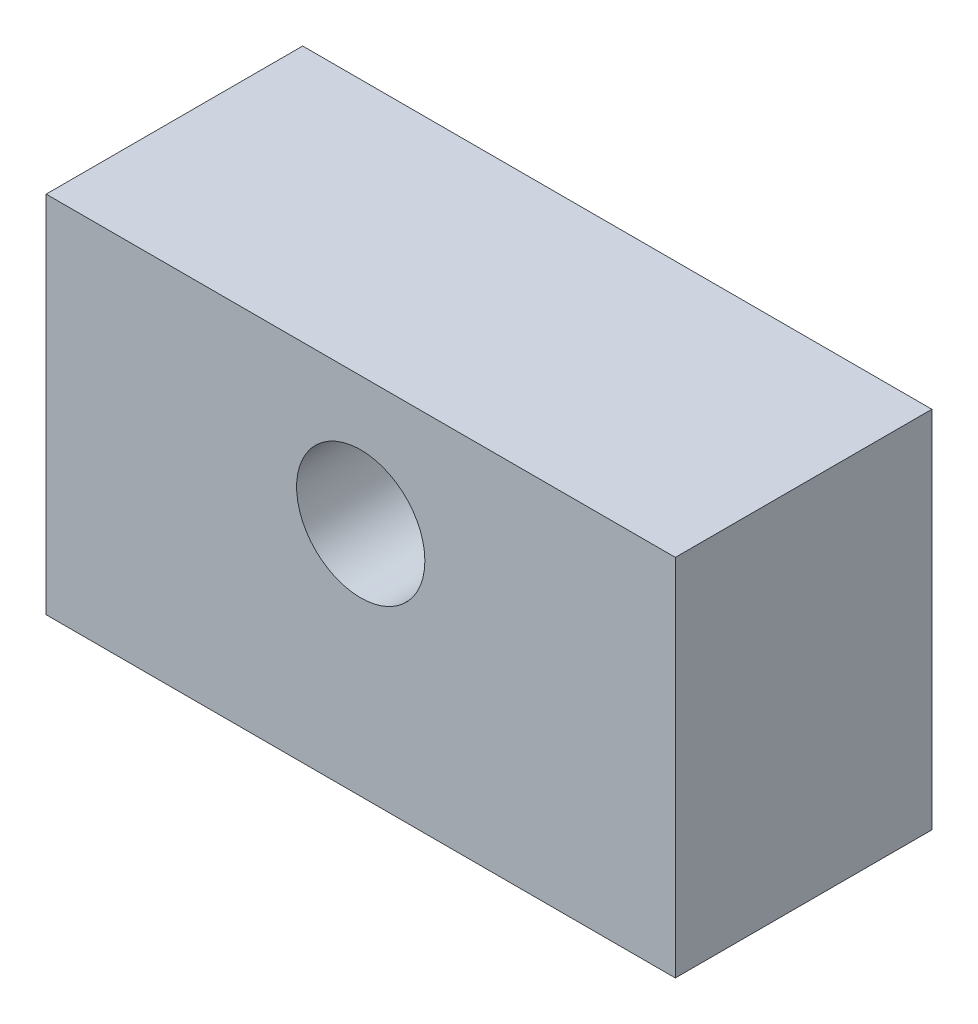
from build123d import *
from build123d.topology import SkipClean

# Parameters (mm, degrees)
SKETCH3_W                      = 31.148374891
SKETCH3_H                      = 19.837641971
BOSS_EXTRUDE1_DEPTH            = 6.35
SKETCH4_R                      = 3.175
CUT_EXTRUDE1_DEPTH             = 9.525
SKETCH5_R                      = 3.175
CUT_EXTRUDE5_DEPTH             = 9.525
CUT_EXTRUDE5_DIRECTION_2_REACH = 33.299
SKETCH6_R                      = 3.175
CUT_EXTRUDE6_DEPTH             = 9.525
SKETCH7_W                      = 12.7
SKETCH7_H                      = 1.803641971
CUT_EXTRUDE7_DEPTH             = 38.470999417


with BuildPart() as part:
    # Sketch3 → Boss-Extrude1 (new, symmetric)
    with BuildSketch(Plane.XY):
        with Locations((15.574187446, -9.918820986)):
            Rectangle(SKETCH3_W, SKETCH3_H)
    extrude(amount=BOSS_EXTRUDE1_DEPTH, both=True)

    # Sketch4 → Cut-Extrude1 (cut)
    with BuildSketch(Plane.ZY):
        with Locations((0, -6.35)):
            Circle(SKETCH4_R)
    extrude(amount=-CUT_EXTRUDE1_DEPTH, mode=Mode.SUBTRACT)

    # Sketch5 → Cut-Extrude5 (cut)
    with BuildSketch(Plane(origin=(7.787093723, -19.837641971, 0), x_dir=(-0.8660254037844382, 0.500000000000001, 0), z_dir=(-0.500000000000001, -0.8660254037844382, 0))):
        Circle(SKETCH5_R)
    cut_extrude5 = extrude(amount=-CUT_EXTRUDE5_DEPTH, mode=Mode.SUBTRACT)

    # Sketch5 → Cut-Extrude5 direction 2 (cut, up to next)
    with BuildSketch(Plane(origin=(7.787093723, -19.837641971, 0), x_dir=(-0.8660254037844382, 0.500000000000001, 0), z_dir=(-0.500000000000001, -0.8660254037844382, 0)), mode=Mode.PRIVATE) as cut_extrude5_direction_2_sk1:
        Circle(SKETCH5_R)
    cut_extrude5_direction_2_tool1 = extrude(cut_extrude5_direction_2_sk1.sketch, amount=CUT_EXTRUDE5_DIRECTION_2_REACH, mode=Mode.PRIVATE) & part.part
    cut_extrude5_direction_2 = cut_extrude5_direction_2_tool1.solids().sort_by_distance((7.787094, -19.837642, 0))[0]
    add(cut_extrude5_direction_2, mode=Mode.SUBTRACT)

    # Sketch6 → Cut-Extrude6 (cut)
    with BuildSketch(Plane(origin=(0, 0, 6.35), x_dir=(-1, 0, 0), z_dir=(0, 0, -1))):
        with Locations((-15.574187445, -6.35)):
            Circle(SKETCH6_R)
    extrude(amount=CUT_EXTRUDE6_DEPTH, mode=Mode.SUBTRACT)

    # Mirror1: Cut-Extrude5, Cut-Extrude5 direction 2 across plane
    with SkipClean():  # the faces are left unmerged after this step: merging them gives an invalid solid
        add(cut_extrude5.mirror(Plane.ZY.offset(-15.574187445)), mode=Mode.SUBTRACT)
        add(cut_extrude5_direction_2.mirror(Plane.ZY.offset(-15.574187445)), mode=Mode.SUBTRACT)

    # Sketch7 → Cut-Extrude7 (cut, through all)
    with BuildSketch(Plane(origin=(31.148374891, 0, 0), x_dir=(0, 0, -1), z_dir=(1, 0, 0))):
        with Locations((0, -18.935820986)):
            Rectangle(SKETCH7_W, SKETCH7_H)
    extrude(amount=-CUT_EXTRUDE7_DEPTH, mode=Mode.SUBTRACT)


solid = part.part
